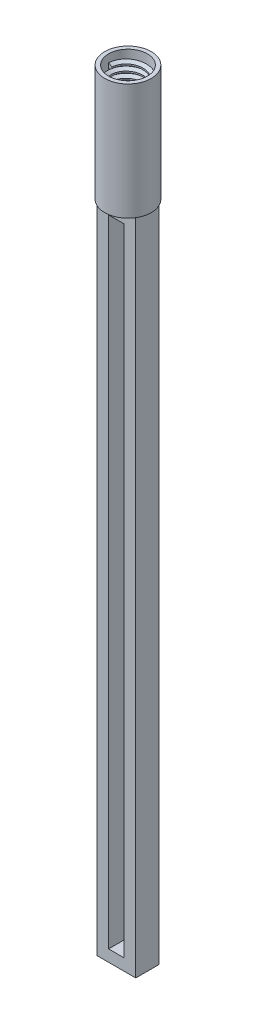
from build123d import *

# Parameters (mm, degrees)
IZIM2_W                     = 5
IZIM2_H                     = 85
IZIM2_W_2                   = 2
IZIM2_H_2                   = 82
Y_KSEKLIK_EKSTR_ZYON1_DEPTH = 3
IZIM3_R                     = 3
Y_KSEKLIK_EKSTR_ZYON2_DEPTH = 15
IZIM4_R                     = 2.5
KES_EKSTR_ZYON1_DEPTH       = 10
DI_1_PITCH                  = 0.8


with BuildPart() as part:
    # Çizim2 → Yükseklik-Ekstrüzyon1 (new body)
    with BuildSketch(Plane.XY):
        with Locations((2.5, 42.5)):
            Rectangle(IZIM2_W, IZIM2_H)
        with Locations((2.5, 42.5)):
            Rectangle(IZIM2_W_2, IZIM2_H_2, mode=Mode.SUBTRACT)
    extrude(amount=Y_KSEKLIK_EKSTR_ZYON1_DEPTH)

    # Çizim3 → Yükseklik-Ekstrüzyon2 (add)
    with BuildSketch(Plane(origin=(0, 85, 0), x_dir=(1, 0, 0), z_dir=(0, 1, 0))):
        with Locations(Location((2.5, -1.5, 0), (0, 0, 270))):
            Circle(IZIM3_R)
    extrude(amount=Y_KSEKLIK_EKSTR_ZYON2_DEPTH)

    # Çizim4 → Kes-Ekstrüzyon1 (cut)
    with BuildSketch(Plane(origin=(0, 100, 0), x_dir=(1, 0, 0), z_dir=(0, 1, 0))):
        with Locations(Location((2.5, -1.5, 0), (0, 0, 270))):
            Circle(IZIM4_R)
    extrude(amount=-KES_EKSTR_ZYON1_DEPTH, mode=Mode.SUBTRACT)

    # Diş1: the profile of Diş Profili1 profile screwed along a right-hand helix of 12.5 turns, 8 arcs to a turn; built about Z, then put on its axis
    di_1_z = Axis((0, 0, 0), (0, 0, 1))
    di_1_corners = [(2.5003, 0, -0.000173205), (2.5003, 0, 0.700173203), (2.0669873, 0, 0.449999999), (2.0669873, 0, 0.249999999)]
    with BuildLine(mode=Mode.PRIVATE) as di_1_profile:
        Line(di_1_corners[0], di_1_corners[1])
        Line(di_1_corners[1], di_1_corners[2])
        Line(di_1_corners[2], di_1_corners[3])
        Line(di_1_corners[3], di_1_corners[0])
    di_1_cap = Face(di_1_profile.wire())
    di_1_turn_angles = [0, 22.5, 45, 67.5, 90, 112.5, 135, 157.5, 180, 202.5, 225, 247.5, 270, 292.5, 315, 337.5, 360]
    di_1_turn_weights = [1, 0.9238795325112867, 1, 0.9238795325112867, 1, 0.9238795325112867, 1, 0.9238795325112867, 1, 0.9238795325112867, 1, 0.9238795325112867, 1, 0.9238795325112867, 1, 0.9238795325112867, 1]
    di_1_turn_rails = [Edge.make_bspline([Vector(p[0], p[1], 0).rotate(di_1_z, di_1_turn_angles[k]) / di_1_turn_weights[k] + Vector(0, 0, p[2] + DI_1_PITCH * di_1_turn_angles[k] / 360) for k in range(17)], [0, 0, 0, 1, 1, 2, 2, 3, 3, 4, 4, 5, 5, 6, 6, 7, 7, 8, 8, 8], 2, di_1_turn_weights) for p in di_1_corners]
    di_1_turn_sides = [Face.make_surface_from_curves(di_1_turn_rails[p[0]], di_1_turn_rails[p[1]]) for p in [(0, 1), (1, 2), (2, 3), (3, 0)]]
    di_1_last_angles = [4320, 4342.5, 4365, 4387.5, 4410, 4432.5, 4455, 4477.5, 4500]
    di_1_last_weights = [1, 0.9238795325112867, 1, 0.9238795325112867, 1, 0.9238795325112867, 1, 0.9238795325112867, 1]
    di_1_last_rails = [Edge.make_bspline([Vector(p[0], p[1], 0).rotate(di_1_z, di_1_last_angles[k]) / di_1_last_weights[k] + Vector(0, 0, p[2] + DI_1_PITCH * di_1_last_angles[k] / 360) for k in range(9)], [0, 0, 0, 1, 1, 2, 2, 3, 3, 4, 4, 4], 2, di_1_last_weights) for p in di_1_corners]
    di_1_last_sides = [Face.make_surface_from_curves(di_1_last_rails[p[0]], di_1_last_rails[p[1]]) for p in [(0, 1), (1, 2), (2, 3), (3, 0)]]
    di_1 = Plane(origin=(2.5, 99, 1.5), x_dir=(-1, 0, 0), z_dir=(0, -1, 0)) * Solid(Shell([*[p.moved(Location((0, 0, DI_1_PITCH * i))) for i in range(12) for p in di_1_turn_sides], *di_1_last_sides, di_1_cap, di_1_cap.rotate(di_1_z, 4500).moved(Location((0, 0, DI_1_PITCH * 4500 / 360)))]))
    add(di_1)


solid = part.part
